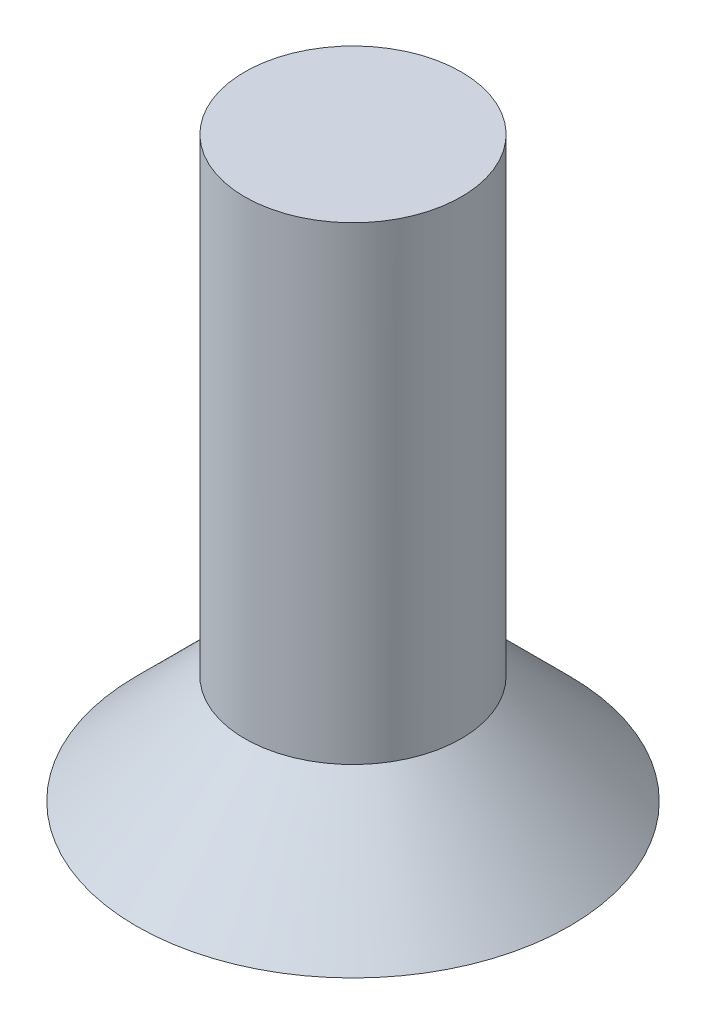
from build123d import *

# Parameters (mm, degrees)
SKETCH1_R           = 3
BOSS_EXTRUDE1_DEPTH = 2.5
SKETCH2_R           = 1.5
BOSS_EXTRUDE2_DEPTH = 5.5
CHAMFER1_SIZE       = 2.5
CUT_EXTRUDE1_DEPTH  = 1


with BuildPart() as part:
    # Sketch1 → Boss-Extrude1 (new body)
    with BuildSketch(Plane(origin=(0, 0, 0), x_dir=(1, 0, 0), z_dir=(0, 1, 0))):
        with Locations(Location((0, 0, 0), (0, 0, 270))):
            Circle(SKETCH1_R)
    extrude(amount=BOSS_EXTRUDE1_DEPTH)

    # Sketch2 → Boss-Extrude2 (add)
    with BuildSketch(Plane(origin=(0, 2.5, 0), x_dir=(1, 0, 0), z_dir=(0, 1, 0))):
        with Locations(Location((0, 0, 0), (0, 0, 270))):
            Circle(SKETCH2_R)
    extrude(amount=BOSS_EXTRUDE2_DEPTH)

    # Chamfer1
    # the kernel refuses this chamfer: 2.5 mm, written as the material it takes off along each edge
    with BuildSketch(Plane(origin=(0, 2.5, 0), x_dir=(0, 0, 1), z_dir=(-1, 0, 0))) as chamfer1_piece_1_section:
        Polygon((3, -CHAMFER1_SIZE), (3 - CHAMFER1_SIZE, 0), (3, 0), align=None)
    chamfer1_piece_1 = revolve(axis=Axis((0, 2.5, 0), (0, 1, 0)), mode=Mode.PRIVATE)
    chamfer1_piece_1 = chamfer1_piece_1 - Plane(origin=(0, 0.739386172, 0), x_dir=(0, 0, 1), z_dir=(0, -1, 0)) * Cylinder(1.5, 12, mode=Mode.PRIVATE)
    add(chamfer1_piece_1, mode=Mode.SUBTRACT)

    # Sketch3 → Cut-Extrude1 (cut)
    with BuildSketch(Plane.XZ):
        Polygon((1.251191911, -0.896964433), (1.402389941, 0.635081763), (0.15119803, 1.532046196), (-1.251191911, 0.896964433), (-1.402389941, -0.635081763), (-0.15119803, -1.532046196), align=None)
    extrude(amount=-CUT_EXTRUDE1_DEPTH, mode=Mode.SUBTRACT)


solid = part.part
